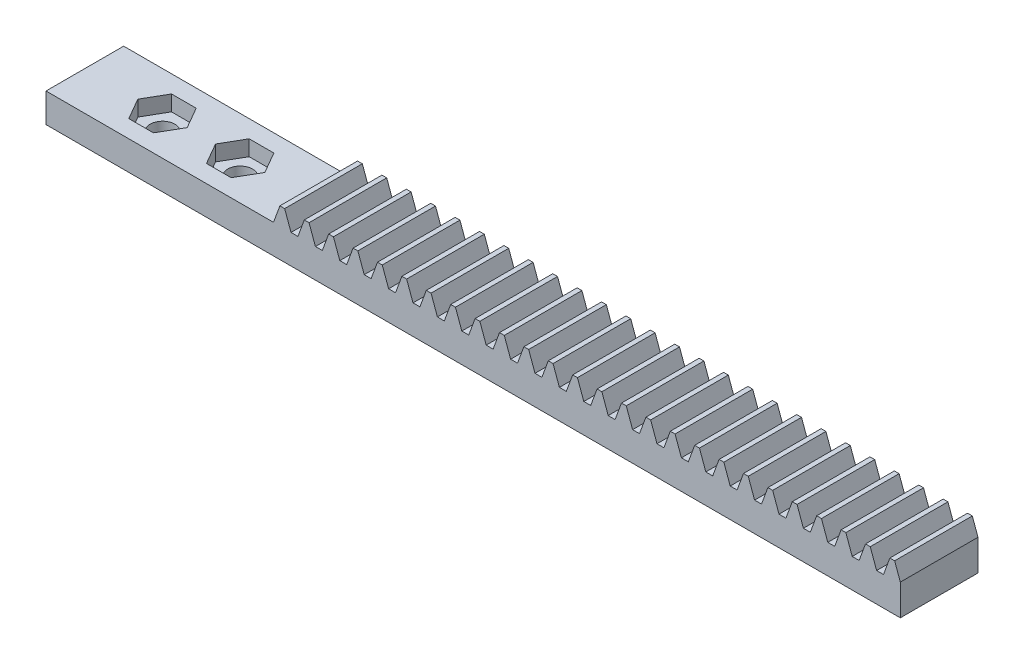
from build123d import *

# Parameters (mm, degrees)
BLANKSKE_W          = 100
BLANKSKE_H          = 6
BLANK_DEPTH         = 10
TOOTHCUTSIM_DEPTH   = 101.677703589
TEETHCUTS_COUNT     = 33
TEETHCUTS_PITCH     = 3.14159265
SKETCH_1_W          = 19.29399127
SKETCH_1_H          = 9.471097972
CUT_EXTRUDE_1_DEPTH = 10
SKETCH_2_W          = 10
SKETCH_2_H          = 3.75
EXTRUDE_1_DEPTH     = 10
SKETCH_3_R          = 1.6
CUT_EXTRUDE_2_DEPTH = 10
CUT_EXTRUDE_3_DEPTH = 2


with BuildPart() as part:
    # BlankSke → Blank (new body)
    with BuildSketch(Plane.XY):
        with Locations((50, 3)):
            Rectangle(BLANKSKE_W, BLANKSKE_H)
    extrude(amount=-BLANK_DEPTH)

    # TooCutSkeSim → ToothCutSim (cut, through all)
    with BuildSketch(Plane.XY):
        Polygon((0.44443537, 3.75), (-0.44443537, 3.75), (-1.272613241, 6.0254), (1.272613241, 6.0254), align=None)
    toothcutsim = extrude(amount=-TOOTHCUTSIM_DEPTH, mode=Mode.SUBTRACT)

    # TeethCuts: ToothCutSim ×33
    with Locations(*[(i * TEETHCUTS_PITCH, 0, 0) for i in range(1, TEETHCUTS_COUNT)]):
        add(toothcutsim, mode=Mode.SUBTRACT)

    # 草图1 → 切除-拉伸1 (cut)
    with BuildSketch(Plane.XY):
        with Locations((9.646995635, 8.485548986)):
            Rectangle(SKETCH_1_W, SKETCH_1_H)
    extrude(amount=-CUT_EXTRUDE_1_DEPTH, mode=Mode.SUBTRACT)

    # 草图2 → 凸台-拉伸1 (add)
    with BuildSketch(Plane.ZY):
        with Locations((-5, 1.875)):
            Rectangle(SKETCH_2_W, SKETCH_2_H)
    extrude(amount=EXTRUDE_1_DEPTH)

    # 草图3 → 切除-拉伸2 (cut)
    with BuildSketch(Plane(origin=(0, 3.75, 0), x_dir=(1, 0, 0), z_dir=(0, 1, 0))):
        with Locations((0, 5)):
            Circle(SKETCH_3_R)
        with Locations((10, 5)):
            Circle(SKETCH_3_R)
    extrude(amount=-CUT_EXTRUDE_2_DEPTH, mode=Mode.SUBTRACT)

    # 草图4 → 切除-拉伸3 (cut)
    with BuildSketch(Plane(origin=(0, 3.75, 0), x_dir=(1, 0, 0), z_dir=(0, 1, 0))):
        Polygon((-1.58771324, 7.75), (-3.175426481, 5), (-1.58771324, 2.25), (1.58771324, 2.25), (3.175426481, 5), (1.58771324, 7.75), align=None)
        Polygon((8.41228676, 7.75), (6.824573519, 5), (8.41228676, 2.25), (11.58771324, 2.25), (13.175426481, 5), (11.58771324, 7.75), align=None)
    extrude(amount=-CUT_EXTRUDE_3_DEPTH, mode=Mode.SUBTRACT)


solid = part.part
